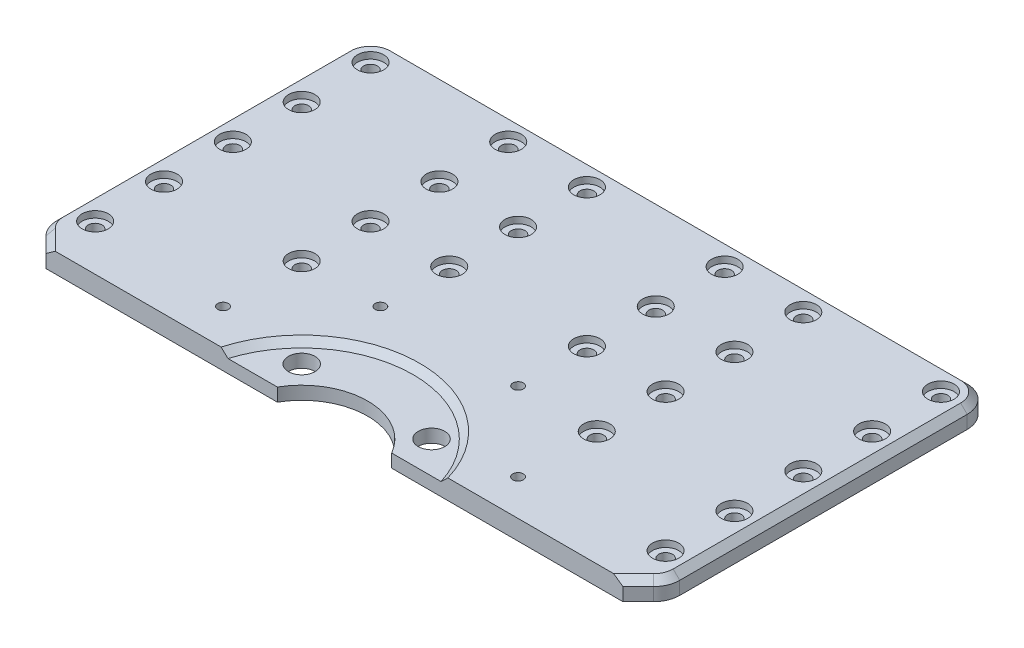
from build123d import *

# Parameters (mm, degrees)
EXTRUDE_1_DEPTH               = 3
HOLE_WIZARD_M2_1_AT_2_COUNT   = 2
HOLE_WIZARD_M2_1_AT_2_PITCH   = 21
PATTERN_LINEAR_1_COUNT        = 3
PATTERN_LINEAR_1_PITCH        = 33
PATTERN_LINEAR_2_COUNT        = 3
PATTERN_LINEAR_2_PITCH        = 10.5
PATTERN_LINEAR_3_COUNT        = 2
PATTERN_LINEAR_3_PITCH        = 31.5
HOLE_WIZARD_M2_1_2_AT_2_COUNT = 2
HOLE_WIZARD_M2_1_2_AT_2_PITCH = 16.970562748
SKETCH_8_R                    = 17
CUT_EXTRUDE_1_DEPTH           = 1
SKETCH_9_R                    = 2.025
CUT_EXTRUDE_2_DEPTH           = 75.994999833
PATTERN_CIRCULAR_1_COUNT      = 2
PATTERN_CIRCULAR_1_ANGLE      = 90
FILLET_1_R                    = 4
CHAMFER_1_SIZE                = 1
SKETCH_11_W                   = 95
SKETCH_11_H                   = 10
CUT_EXTRUDE_3_DEPTH           = 76.028327984


with BuildPart() as part:
    # ｽｹｯﾁ1 → ﾎﾞｽ - 押し出し1 (new body)
    with BuildSketch(Plane(origin=(0, 0, 0), x_dir=(1, 0, 0), z_dir=(0, 1, 0))):
        with BuildLine():
            Line((-10.05, 0), (-39, 0))
            Line((-39, 0), (-47.5, 8.5))
            Line((-47.5, 8.5), (-47.5, 58))
            Line((-47.5, 58), (47.5, 58))
            Line((47.5, 58), (47.5, 8.5))
            Line((47.5, 8.5), (39, 0))
            Line((39, 0), (10.05, 0))
            ThreePointArc((10.05, 0), (0, 10.05), (-10.05, 0))
        make_face()
    extrude(amount=EXTRUDE_1_DEPTH)

    # ｽｹｯﾁ3 → Hole Wizard M2 _1 (revolve, cut)
    with BuildSketch(Plane(origin=(-43.5, 3, -54), x_dir=(0, 0, 1), z_dir=(1, 0, 0))):
        Polygon((0, 0), (0, 4.63090365), (1.05, 4), (1.05, 1), (2, 1), (2, 0), align=None)
    hole_wizard_m2_1 = revolve(axis=Axis((-43.5, 9.35, -54), (0, -1, 0)), mode=Mode.SUBTRACT)

    # Hole Wizard M2 _1 at 2: Hole Wizard M2 _1 ×2
    with Locations(*[(i * HOLE_WIZARD_M2_1_AT_2_PITCH, 0, 0) for i in range(1, HOLE_WIZARD_M2_1_AT_2_COUNT)]):
        add(hole_wizard_m2_1, mode=Mode.SUBTRACT)

    # 直線ﾊﾟﾀｰﾝ1: Hole Wizard M2 _1 ×3
    with Locations(*[(i * PATTERN_LINEAR_1_PITCH, 0, 0) for i in range(1, PATTERN_LINEAR_1_COUNT)]):
        add(hole_wizard_m2_1, mode=Mode.SUBTRACT)

    # 直線ﾊﾟﾀｰﾝ1 copy 1 sketch → 直線ﾊﾟﾀｰﾝ1 copy 1 (revolve, cut)
    with BuildSketch(Plane(origin=(10.5, 3, -54), x_dir=(0, 0, 1), z_dir=(1, 0, 0))):
        Polygon((0, 0), (0, 4.63090365), (1.05, 4), (1.05, 1), (2, 1), (2, 0), align=None)
    revolve(axis=Axis((10.5, 9.35, -54), (0, -1, 0)), mode=Mode.SUBTRACT)

    # 直線ﾊﾟﾀｰﾝ1 copy 2 sketch → 直線ﾊﾟﾀｰﾝ1 copy 2 (revolve, cut)
    with BuildSketch(Plane(origin=(43.5, 3, -54), x_dir=(0, 0, 1), z_dir=(1, 0, 0))):
        Polygon((0, 0), (0, 4.63090365), (1.05, 4), (1.05, 1), (2, 1), (2, 0), align=None)
    revolve(axis=Axis((43.5, 9.35, -54), (0, -1, 0)), mode=Mode.SUBTRACT)

    # 直線ﾊﾟﾀｰﾝ2: Hole Wizard M2 _1 ×3
    with Locations(*[(0, 0, i * PATTERN_LINEAR_2_PITCH) for i in range(1, PATTERN_LINEAR_2_COUNT)]):
        add(hole_wizard_m2_1, mode=Mode.SUBTRACT)

    # 直線ﾊﾟﾀｰﾝ2 copy 1 sketch → 直線ﾊﾟﾀｰﾝ2 copy 1 (revolve, cut)
    with BuildSketch(Plane(origin=(-22.5, 3, -43.5), x_dir=(0, 0, 1), z_dir=(1, 0, 0))):
        Polygon((0, 0), (0, 4.63090365), (1.05, 4), (1.05, 1), (2, 1), (2, 0), align=None)
    revolve(axis=Axis((-22.5, 9.35, -43.5), (0, -1, 0)), mode=Mode.SUBTRACT)

    # 直線ﾊﾟﾀｰﾝ2 copy 2 sketch → 直線ﾊﾟﾀｰﾝ2 copy 2 (revolve, cut)
    with BuildSketch(Plane(origin=(-22.5, 3, -33), x_dir=(0, 0, 1), z_dir=(1, 0, 0))):
        Polygon((0, 0), (0, 4.63090365), (1.05, 4), (1.05, 1), (2, 1), (2, 0), align=None)
    revolve(axis=Axis((-22.5, 9.35, -33), (0, -1, 0)), mode=Mode.SUBTRACT)

    # 直線ﾊﾟﾀｰﾝ2 copy 3 sketch → 直線ﾊﾟﾀｰﾝ2 copy 3 (revolve, cut)
    with BuildSketch(Plane(origin=(-10.5, 3, -43.5), x_dir=(0, 0, 1), z_dir=(1, 0, 0))):
        Polygon((0, 0), (0, 4.63090365), (1.05, 4), (1.05, 1), (2, 1), (2, 0), align=None)
    revolve(axis=Axis((-10.5, 9.35, -43.5), (0, -1, 0)), mode=Mode.SUBTRACT)

    # 直線ﾊﾟﾀｰﾝ2 copy 4 sketch → 直線ﾊﾟﾀｰﾝ2 copy 4 (revolve, cut)
    with BuildSketch(Plane(origin=(-10.5, 3, -33), x_dir=(0, 0, 1), z_dir=(1, 0, 0))):
        Polygon((0, 0), (0, 4.63090365), (1.05, 4), (1.05, 1), (2, 1), (2, 0), align=None)
    revolve(axis=Axis((-10.5, 9.35, -33), (0, -1, 0)), mode=Mode.SUBTRACT)

    # 直線ﾊﾟﾀｰﾝ2 copy 5 sketch → 直線ﾊﾟﾀｰﾝ2 copy 5 (revolve, cut)
    with BuildSketch(Plane(origin=(22.5, 3, -43.5), x_dir=(0, 0, 1), z_dir=(1, 0, 0))):
        Polygon((0, 0), (0, 4.63090365), (1.05, 4), (1.05, 1), (2, 1), (2, 0), align=None)
    revolve(axis=Axis((22.5, 9.35, -43.5), (0, -1, 0)), mode=Mode.SUBTRACT)

    # 直線ﾊﾟﾀｰﾝ2 copy 6 sketch → 直線ﾊﾟﾀｰﾝ2 copy 6 (revolve, cut)
    with BuildSketch(Plane(origin=(22.5, 3, -33), x_dir=(0, 0, 1), z_dir=(1, 0, 0))):
        Polygon((0, 0), (0, 4.63090365), (1.05, 4), (1.05, 1), (2, 1), (2, 0), align=None)
    revolve(axis=Axis((22.5, 9.35, -33), (0, -1, 0)), mode=Mode.SUBTRACT)

    # 直線ﾊﾟﾀｰﾝ2 copy 7 sketch → 直線ﾊﾟﾀｰﾝ2 copy 7 (revolve, cut)
    with BuildSketch(Plane(origin=(10.5, 3, -43.5), x_dir=(0, 0, 1), z_dir=(1, 0, 0))):
        Polygon((0, 0), (0, 4.63090365), (1.05, 4), (1.05, 1), (2, 1), (2, 0), align=None)
    revolve(axis=Axis((10.5, 9.35, -43.5), (0, -1, 0)), mode=Mode.SUBTRACT)

    # 直線ﾊﾟﾀｰﾝ2 copy 8 sketch → 直線ﾊﾟﾀｰﾝ2 copy 8 (revolve, cut)
    with BuildSketch(Plane(origin=(10.5, 3, -33), x_dir=(0, 0, 1), z_dir=(1, 0, 0))):
        Polygon((0, 0), (0, 4.63090365), (1.05, 4), (1.05, 1), (2, 1), (2, 0), align=None)
    revolve(axis=Axis((10.5, 9.35, -33), (0, -1, 0)), mode=Mode.SUBTRACT)

    # 直線ﾊﾟﾀｰﾝ2 copy 9 sketch → 直線ﾊﾟﾀｰﾝ2 copy 9 (revolve, cut)
    with BuildSketch(Plane(origin=(43.5, 3, -43.5), x_dir=(0, 0, 1), z_dir=(1, 0, 0))):
        Polygon((0, 0), (0, 4.63090365), (1.05, 4), (1.05, 1), (2, 1), (2, 0), align=None)
    revolve(axis=Axis((43.5, 9.35, -43.5), (0, -1, 0)), mode=Mode.SUBTRACT)

    # 直線ﾊﾟﾀｰﾝ2 copy 10 sketch → 直線ﾊﾟﾀｰﾝ2 copy 10 (revolve, cut)
    with BuildSketch(Plane(origin=(43.5, 3, -33), x_dir=(0, 0, 1), z_dir=(1, 0, 0))):
        Polygon((0, 0), (0, 4.63090365), (1.05, 4), (1.05, 1), (2, 1), (2, 0), align=None)
    revolve(axis=Axis((43.5, 9.35, -33), (0, -1, 0)), mode=Mode.SUBTRACT)

    # 直線ﾊﾟﾀｰﾝ3: Hole Wizard M2 _1 ×2
    with Locations(*[(0, 0, i * PATTERN_LINEAR_3_PITCH) for i in range(1, PATTERN_LINEAR_3_COUNT)]):
        add(hole_wizard_m2_1, mode=Mode.SUBTRACT)

    # 直線ﾊﾟﾀｰﾝ3 copy 1 sketch → 直線ﾊﾟﾀｰﾝ3 copy 1 (revolve, cut)
    with BuildSketch(Plane(origin=(-22.5, 3, -22.5), x_dir=(0, 0, 1), z_dir=(1, 0, 0))):
        Polygon((0, 0), (0, 4.63090365), (1.05, 4), (1.05, 1), (2, 1), (2, 0), align=None)
    revolve(axis=Axis((-22.5, 9.35, -22.5), (0, -1, 0)), mode=Mode.SUBTRACT)

    # ｽｹｯﾁ5 → Hole Wizard M2 _1 2 (revolve, cut)
    with BuildSketch(Plane(origin=(-10.5, 3, -22.5), x_dir=(0, 0, 1), z_dir=(1, 0, 0))):
        Polygon((0, 0), (0, 6.480688495), (0.8, 6), (0.8, 0), align=None)
    hole_wizard_m2_1_2 = revolve(axis=Axis((-10.5, 9.35, -22.5), (0, -1, 0)), mode=Mode.SUBTRACT)

    # Hole Wizard M2 _1 2 at 2: Hole Wizard M2 _1 2 ×2
    with Locations(*[Vector(-0.7071067811865469, 0, 0.7071067811865482) * (i * HOLE_WIZARD_M2_1_2_AT_2_PITCH) for i in range(1, HOLE_WIZARD_M2_1_2_AT_2_COUNT)]):
        add(hole_wizard_m2_1_2, mode=Mode.SUBTRACT)

    # ｽｹｯﾁ7 → M2 なべ頭ねじ用座ぐり穴2 (revolve, cut)
    with BuildSketch(Plane(origin=(-43.5, 3, -12), x_dir=(0, 0, 1), z_dir=(1, 0, 0))):
        Polygon((0, 0), (0, 6.63090365), (1.05, 6), (1.05, 1), (2, 1), (2, 0), align=None)
    hole_wizard_m2_2 = revolve(axis=Axis((-43.5, 9.35, -12), (0, -1, 0)), mode=Mode.SUBTRACT)

    # ﾐﾗｰ1: Hole Wizard M2 _1 2, M2 なべ頭ねじ用座ぐり穴2 across plane
    add(hole_wizard_m2_1_2.mirror(Plane(origin=(0, 0, 0), x_dir=(0, 0, 1), z_dir=(1, 0, 0))), mode=Mode.SUBTRACT)
    add(hole_wizard_m2_2.mirror(Plane(origin=(0, 0, 0), x_dir=(0, 0, 1), z_dir=(1, 0, 0))), mode=Mode.SUBTRACT)

    # ﾐﾗｰ1 copy 1 sketch → ﾐﾗｰ1 copy 1 (revolve, cut)
    with BuildSketch(Plane(origin=(43.5, 3, -22.5), x_dir=(0, 0, 1), z_dir=(-1, 0, 0))):
        Polygon((0, 0), (0, -4.63090365), (1.05, -4), (1.05, -1), (2, -1), (2, 0), align=None)
    revolve(axis=Axis((43.5, 9.35, -22.5), (0, 1, 0)), mode=Mode.SUBTRACT)

    # ﾐﾗｰ1 copy 2 sketch → ﾐﾗｰ1 copy 2 (revolve, cut)
    with BuildSketch(Plane(origin=(22.5, 3, -22.5), x_dir=(0, 0, 1), z_dir=(-1, 0, 0))):
        Polygon((0, 0), (0, -4.63090365), (1.05, -4), (1.05, -1), (2, -1), (2, 0), align=None)
    revolve(axis=Axis((22.5, 9.35, -22.5), (0, 1, 0)), mode=Mode.SUBTRACT)

    # ﾐﾗｰ1 copy 3 sketch → ﾐﾗｰ1 copy 3 (revolve, cut)
    with BuildSketch(Plane(origin=(43.5, 3, -54), x_dir=(0, 0, 1), z_dir=(-1, 0, 0))):
        Polygon((0, 0), (0, -4.63090365), (1.05, -4), (1.05, -1), (2, -1), (2, 0), align=None)
    revolve(axis=Axis((43.5, 9.35, -54), (0, 1, 0)), mode=Mode.SUBTRACT)

    # ﾐﾗｰ1 copy 4 sketch → ﾐﾗｰ1 copy 4 (revolve, cut)
    with BuildSketch(Plane(origin=(22.5, 3, -54), x_dir=(0, 0, 1), z_dir=(-1, 0, 0))):
        Polygon((0, 0), (0, -4.63090365), (1.05, -4), (1.05, -1), (2, -1), (2, 0), align=None)
    revolve(axis=Axis((22.5, 9.35, -54), (0, 1, 0)), mode=Mode.SUBTRACT)

    # ﾐﾗｰ1 copy 5 sketch → ﾐﾗｰ1 copy 5 (revolve, cut)
    with BuildSketch(Plane(origin=(22.5, 3, -10.5), x_dir=(0, 0, 1), z_dir=(-1, 0, 0))):
        Polygon((0, 0), (0, -6.480688495), (0.8, -6), (0.8, 0), align=None)
    revolve(axis=Axis((22.5, 9.35, -10.5), (0, 1, 0)), mode=Mode.SUBTRACT)

    # ｽｹｯﾁ8 → ｶｯﾄ - 押し出し1 (cut)
    with BuildSketch(Plane(origin=(0, 3, 0), x_dir=(1, 0, 0), z_dir=(0, 1, 0))):
        Circle(SKETCH_8_R)
    extrude(amount=-CUT_EXTRUDE_1_DEPTH, mode=Mode.SUBTRACT)

    # ｽｹｯﾁ9 → ｶｯﾄ - 押し出し2 (cut, through all)
    with BuildSketch(Plane(origin=(0, 2, 0), x_dir=(1, 0, 0), z_dir=(0, 1, 0))):
        with Locations(Location((-9.899494937, 9.899494937, 0), (0, 0, 270))):
            Circle(SKETCH_9_R)
    cut_extrude_2 = extrude(amount=-CUT_EXTRUDE_2_DEPTH, mode=Mode.SUBTRACT)

    # 円形ﾊﾟﾀｰﾝ1: ｶｯﾄ - 押し出し2 ×2 about axis
    pattern_circular_1_axis = Axis((0, 3, 0), (0, -1, 0))
    for i in range(1, PATTERN_CIRCULAR_1_COUNT):
        add(cut_extrude_2.rotate(pattern_circular_1_axis, i * PATTERN_CIRCULAR_1_ANGLE / (PATTERN_CIRCULAR_1_COUNT - 1)), mode=Mode.SUBTRACT)

    # ﾌｨﾚｯﾄ1
    fillet_1_edges = [part.edges().sort_by_distance(p)[0] for p in [
        (-47.5, 1.5, -8.5),
        (-47.5, 1.5, -58),
        (47.5, 1.5, -58),
        (47.5, 1.5, -8.5),
        (39, 1.5, 0),
        (-39, 1.5, 0),
    ]]
    fillet(fillet_1_edges, radius=FILLET_1_R)

    # 面取り1
    chamfer_1_edges = [part.edges().sort_by_distance(p)[0] for p in [
        (0, 3, -17),
        (27.171572875, 3, 0),
        (38.87387948, 3, -0.30448187),
        (43.25, 3, -4.25),
        (47.19551813, 3, -8.62612052),
        (47.5, 3, -32.078427125),
        (-27.171572875, 3, 0),
        (46.328427125, 3, -56.828427125),
        (-38.87387948, 3, -0.30448187),
        (0, 3, -58),
        (-43.25, 3, -4.25),
        (-46.328427125, 3, -56.828427125),
        (-47.19551813, 3, -8.62612052),
        (-47.5, 3, -32.078427125),
    ]]
    chamfer(chamfer_1_edges, length=CHAMFER_1_SIZE - 0.0001)  # a hair under: the kernel refuses the full size

    # ｽｹｯﾁ11 → ｶｯﾄ - 押し出し3 (cut, through all)
    with BuildSketch(Plane(origin=(0, 3, 0), x_dir=(1, 0, 0), z_dir=(0, 1, 0))):
        Rectangle(SKETCH_11_W, SKETCH_11_H)
    extrude(amount=-CUT_EXTRUDE_3_DEPTH, mode=Mode.SUBTRACT)


solid = part.part
